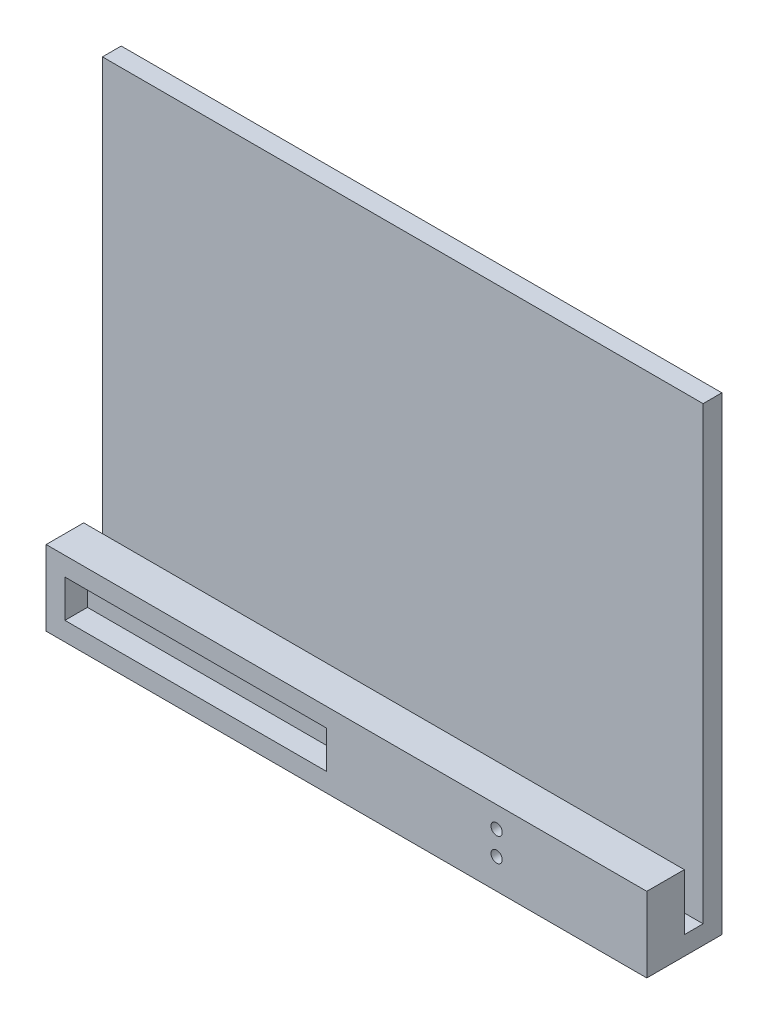
from build123d import *

# Parameters (mm, degrees)
SKETCH1_W           = 203.2
SKETCH1_H           = 158.75
BOSS_EXTRUDE1_DEPTH = 6.35
SKETCH2_W           = 203.2
SKETCH2_H           = 6.35
BOSS_EXTRUDE2_DEPTH = 19.05
SKETCH3_W           = 203.2
SKETCH3_H           = 12.7
BOSS_EXTRUDE3_DEPTH = 19.05
SKETCH4_W           = 88.555771164
SKETCH4_H           = 12.7
CUT_EXTRUDE1_DEPTH  = 7.62
CUT_EXTRUDE2_REACH  = 261.108
SKETCH5_R           = 1.905


with BuildPart() as part:
    # Sketch1 → Boss-Extrude1 (new body)
    with BuildSketch(Plane.XY):
        with Locations((101.6, 79.375)):
            Rectangle(SKETCH1_W, SKETCH1_H)
    extrude(amount=BOSS_EXTRUDE1_DEPTH)

    # Sketch2 → Boss-Extrude2 (add)
    with BuildSketch(Plane.XY.offset(6.35)):
        with Locations((101.6, 3.175)):
            Rectangle(SKETCH2_W, SKETCH2_H)
    extrude(amount=BOSS_EXTRUDE2_DEPTH)

    # Sketch3 → Boss-Extrude3 (add)
    with BuildSketch(Plane(origin=(0, 6.35, 0), x_dir=(1, 0, 0), z_dir=(0, 1, 0))):
        with Locations((101.6, -19.05)):
            Rectangle(SKETCH3_W, SKETCH3_H)
    extrude(amount=BOSS_EXTRUDE3_DEPTH)

    # Sketch4 → Cut-Extrude1 (cut)
    with BuildSketch(Plane.XY.offset(25.4)):
        with Locations((50.627885582, 12.7)):
            Rectangle(SKETCH4_W, SKETCH4_H)
    extrude(amount=-CUT_EXTRUDE1_DEPTH, mode=Mode.SUBTRACT)

    # Sketch5 → Cut-Extrude2 (cut, up to next)
    with BuildSketch(Plane.XY.offset(25.4), mode=Mode.PRIVATE) as cut_extrude2_sk1:
        with Locations((152.4, 18.196330906)):
            Circle(SKETCH5_R)
    cut_extrude2_tool1 = extrude(cut_extrude2_sk1.sketch, amount=-CUT_EXTRUDE2_REACH, mode=Mode.PRIVATE) & part.part
    # Sketch5 → Cut-Extrude2 (cut, up to next)
    with BuildSketch(Plane.XY.offset(25.4), mode=Mode.PRIVATE) as cut_extrude2_sk2:
        with Locations((152.4, 10.16)):
            Circle(SKETCH5_R)
    cut_extrude2_tool2 = extrude(cut_extrude2_sk2.sketch, amount=-CUT_EXTRUDE2_REACH, mode=Mode.PRIVATE) & part.part
    add(cut_extrude2_tool1.solids().sort_by_distance((152.4, 18.196331, 25.4))[0], mode=Mode.SUBTRACT)
    add(cut_extrude2_tool2.solids().sort_by_distance((152.4, 10.16, 25.4))[0], mode=Mode.SUBTRACT)


solid = part.part
